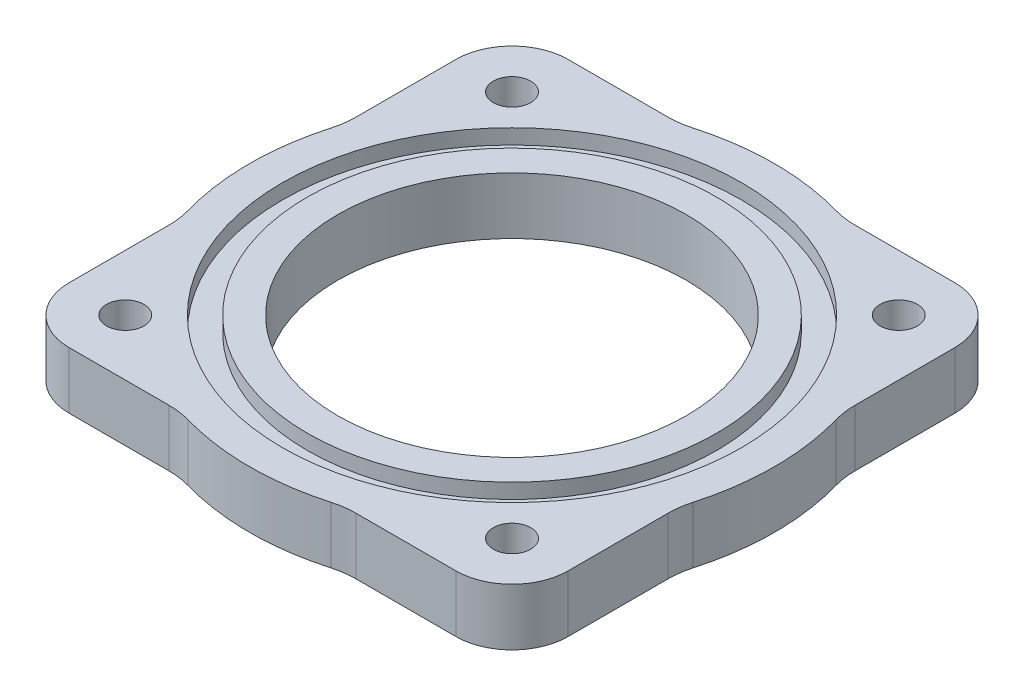
from build123d import *

# Parameters (mm, degrees)
SKETCH1_R           = 22.1742
SKETCH1_R_2         = 2.38125
BOSS_EXTRUDE1_DEPTH = 7.239
SKETCH2_R           = 29.21
SKETCH2_R_2         = 26.035
CUT_EXTRUDE1_DEPTH  = 1.905


with BuildPart() as part:
    # Sketch1 → Boss-Extrude1 (new body)
    with BuildSketch(Plane(origin=(0, 0, 0), x_dir=(1, 0, 0), z_dir=(0, 1, 0))):
        with BuildLine():
            Line((0, 43.62908334), (0, 56.35625))
            ThreePointArc((0, 56.35625), (2.092355932, 61.407644068), (7.14375, 63.5))
            Line((7.14375, 63.5), (19.87091666, 63.5))
            ThreePointArc((19.87091666, 63.5), (21.269548228, 63.596728676), (22.641548343, 63.885072886))
            ThreePointArc((22.641548343, 63.885072886), (31.75, 65.151), (40.858451657, 63.885072886))
            ThreePointArc((40.858451657, 63.885072886), (42.230451772, 63.596728676), (43.62908334, 63.5))
            Line((43.62908334, 63.5), (56.35625, 63.5))
            ThreePointArc((56.35625, 63.5), (61.407644068, 61.407644068), (63.5, 56.35625))
            Line((63.5, 56.35625), (63.5, 43.62908334))
            ThreePointArc((63.5, 43.62908334), (63.596728676, 42.230451772), (63.885072886, 40.858451657))
            ThreePointArc((63.885072886, 40.858451657), (65.151, 31.75), (63.885072886, 22.641548343))
            ThreePointArc((63.885072886, 22.641548343), (63.596728676, 21.269548228), (63.5, 19.87091666))
            Line((63.5, 19.87091666), (63.5, 7.14375))
            ThreePointArc((63.5, 7.14375), (61.407644068, 2.092355932), (56.35625, 0))
            Line((56.35625, 0), (43.62908334, 0))
            ThreePointArc((43.62908334, 0), (42.230451772, -0.096728676), (40.858451657, -0.385072886))
            ThreePointArc((40.858451657, -0.385072886), (31.75, -1.651), (22.641548343, -0.385072886))
            ThreePointArc((22.641548343, -0.385072886), (21.269548228, -0.096728676), (19.87091666, 0))
            Line((19.87091666, 0), (7.14375, 0))
            ThreePointArc((7.14375, 0), (2.092355932, 2.092355932), (0, 7.14375))
            Line((0, 7.14375), (0, 19.87091666))
            ThreePointArc((0, 19.87091666), (-0.096728676, 21.269548228), (-0.385072886, 22.641548343))
            ThreePointArc((-0.385072886, 22.641548343), (-1.651, 31.75), (-0.385072886, 40.858451657))
            ThreePointArc((-0.385072886, 40.858451657), (-0.096728676, 42.230451772), (0, 43.62908334))
        make_face()
        with Locations((31.75, 31.75)):
            Circle(SKETCH1_R, mode=Mode.SUBTRACT)
        with Locations((56.35625, 56.35625)):
            Circle(SKETCH1_R_2, mode=Mode.SUBTRACT)
        with Locations((56.35625, 7.14375)):
            Circle(SKETCH1_R_2, mode=Mode.SUBTRACT)
        with Locations((7.14375, 7.14375)):
            Circle(SKETCH1_R_2, mode=Mode.SUBTRACT)
        with Locations((7.14375, 56.35625)):
            Circle(SKETCH1_R_2, mode=Mode.SUBTRACT)
    extrude(amount=-BOSS_EXTRUDE1_DEPTH)

    # Sketch2 → Cut-Extrude1 (cut)
    with BuildSketch(Plane(origin=(0, 0, 0), x_dir=(1, 0, 0), z_dir=(0, 1, 0))):
        with Locations((31.75, 31.75)):
            Circle(SKETCH2_R)
        with Locations((31.75, 31.75)):
            Circle(SKETCH2_R_2, mode=Mode.SUBTRACT)
    extrude(amount=-CUT_EXTRUDE1_DEPTH, mode=Mode.SUBTRACT)


solid = part.part
